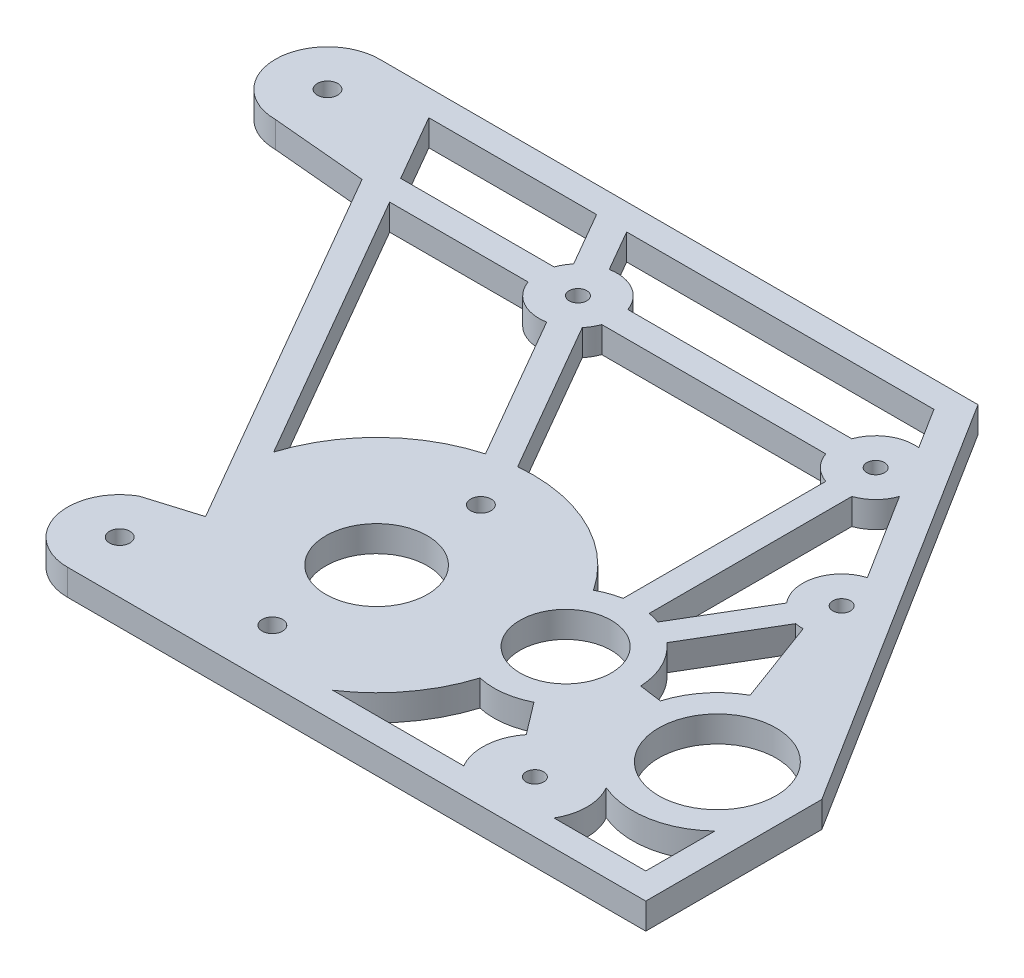
from build123d import *

# Parameters (mm, degrees)
SKETCH1_R           = 2.4892
SKETCH1_R_2         = 14.3002
SKETCH1_R_3         = 11.1252
SKETCH1_R_4         = 12.3825
BOSS_EXTRUDE1_DEPTH = 6.35
SKETCH2_R           = 2.15265
CUT_EXTRUDE2_DEPTH  = 196.570791382


with BuildPart() as part:
    # Sketch1 → Boss-Extrude1 (new body)
    with BuildSketch(Plane(origin=(0, 0, 0), x_dir=(1, 0, 0), z_dir=(0, 1, 0))):
        with BuildLine():
            ThreePointArc((-168.788743889, 72.590962133), (-181.488743889, 59.890962122), (-168.788743866, 47.190962133))
            Line((-168.788743866, 47.190962133), (-145.58139547, 45.094655563))
            Line((-145.58139547, 45.094655563), (-93.510572414, -45.094655563))
            Line((-93.510572414, -45.094655563), (-105.98261767, -48.892439505))
            ThreePointArc((-105.98261767, -48.892439505), (-111.899875664, -63.177964006), (-99.63261767, -72.590962133))
            Line((-99.63261767, -72.590962133), (47.56445351, -72.590962133))
            Line((47.56445351, -72.590962133), (47.56445351, 72.590962133))
            Line((47.56445351, 72.590962133), (-168.788743889, 72.590962133))
        make_face()
        with Locations((-168.788743889, 59.890962133)):
            Circle(SKETCH1_R, mode=Mode.SUBTRACT)
        with Locations((20.56425351, -34.490962133)):
            Circle(SKETCH1_R_2, mode=Mode.SUBTRACT)
        with Locations((-22.22178223, -28.671379192)):
            Circle(SKETCH1_R_3, mode=Mode.SUBTRACT)
        with Locations((-62.44294649, -9.090962133)):
            Circle(SKETCH1_R, mode=Mode.SUBTRACT)
        with Locations((-62.44294649, -34.490962133)):
            Circle(SKETCH1_R_4, mode=Mode.SUBTRACT)
        with Locations((-62.44294649, -59.890962133)):
            Circle(SKETCH1_R, mode=Mode.SUBTRACT)
        with Locations((-99.63261767, -59.890962133)):
            Circle(SKETCH1_R, mode=Mode.SUBTRACT)
    extrude(amount=BOSS_EXTRUDE1_DEPTH)

    # Sketch2 → Cut-Extrude2 (cut, through all)
    with BuildSketch(Plane(origin=(0, 6.35, 0), x_dir=(1, 0, 0), z_dir=(0, 1, 0))):
        with BuildLine():
            Line((-109.602027453, 66.240962133), (-150.457872842, 66.240962133))
            Line((-150.457872842, 66.240962133), (-141.094562242, 50.023232447))
            Line((-141.094562242, 50.023232447), (-103.71971166, 50.023232447))
            ThreePointArc((-103.71971166, 50.023232447), (-102.98834751, 51.610732447), (-101.979214256, 53.03786238))
            Line((-101.979214256, 53.03786238), (-109.602027453, 66.240962133))
        make_face()
        with BuildLine():
            Line((-27.415955353, 66.240962133), (-102.269679034, 66.240962133))
            Line((-102.269679034, 66.240962133), (-96.479952942, 56.21286238))
            ThreePointArc((-96.479952942, 56.21286238), (-89.976955539, 55.097124418), (-85.759199418, 50.023232447))
            Line((-85.759199418, 50.023232447), (-31.202038352, 50.023232447))
            ThreePointArc((-31.202038352, 50.023232447), (-27.287897574, 54.914216598), (-21.182472547, 56.31636111))
            Line((-21.182472547, 56.31636111), (-27.415955353, 66.240962133))
        make_face()
        Polygon((-23.035115437, 72.590962133), (41.21445351, -29.703590933), (41.21445351, -72.590962133), (47.56445351, -72.590962133), (47.56445351, 72.590962133), align=None)
        with BuildLine():
            Line((-103.71971166, 43.673232447), (-137.428388033, 43.673232447))
            Line((-137.428388033, 43.673232447), (-98.827143013, -23.186085162))
            ThreePointArc((-98.827143013, -23.186085162), (-88.972030152, -7.144706081), (-72.639137705, 2.219359096))
            Line((-72.639137705, 2.219359096), (-92.998958135, 37.483602514))
            ThreePointArc((-92.998958135, 37.483602514), (-99.501955539, 38.599340476), (-103.71971166, 43.673232447))
        make_face()
        with BuildLine():
            ThreePointArc((-26.036833474, -45.725059119), (-31.933433069, -57.311557893), (-41.382379071, -66.240962133))
            Line((-41.382379071, -66.240962133), (-9.484269118, -66.240962133))
            ThreePointArc((-9.484269118, -66.240962133), (-11.152631367, -58.974431983), (-8.455564218, -52.023768575))
            Line((-8.455564218, -52.023768575), (-14.348733734, -44.272588197))
            ThreePointArc((-14.348733734, -44.272588197), (-20.066729245, -46.013188834), (-26.036833474, -45.725059119))
        make_face()
        with BuildLine():
            Line((-87.499696821, 40.658602514), (-66.012373687, 3.441467126))
            ThreePointArc((-66.012373687, 3.441467126), (-46.037667348, -0.103801502), (-30.714155868, -13.398455272))
            ThreePointArc((-30.714155868, -13.398455272), (-28.133236556, -12.226400542), (-25.39678223, -11.487026133))
            Line((-25.39678223, -11.487026133), (-25.39678223, 37.867976326))
            ThreePointArc((-25.39678223, 37.867976326), (-28.956974321, 40.113040356), (-31.202038352, 43.673232447))
            Line((-31.202038352, 43.673232447), (-85.759199418, 43.673232447))
            ThreePointArc((-85.759199418, 43.673232447), (-86.490563568, 42.085732447), (-87.499696821, 40.658602514))
        make_face()
        with BuildLine():
            Line((-0.032923472, 22.643237608), (-13.241526109, 43.673232447))
            ThreePointArc((-13.241526109, 43.673232447), (-15.48659014, 40.113040356), (-19.04678223, 37.867976326))
            Line((-19.04678223, 37.867976326), (-19.04678223, -11.487026133))
            ThreePointArc((-19.04678223, -11.487026133), (-17.602770585, -11.817674956), (-16.191951442, -12.269435535))
            Line((-16.191951442, -12.269435535), (-4.509739846, 7.442564285))
            ThreePointArc((-4.509739846, 7.442564285), (-6.336897432, 16.240268394), (-0.032923472, 22.643237608))
        make_face()
        with BuildLine():
            ThreePointArc((12.486538167, -53.495731926), (14.214226599, -59.864817331), (12.512776138, -66.240962133))
            Line((12.512776138, -66.240962133), (34.86445351, -66.240962133))
            Line((34.86445351, -66.240962133), (34.86445351, -49.388446484))
            ThreePointArc((34.86445351, -49.388446484), (24.29215872, -54.801882417), (12.486538167, -53.495731926))
        make_face()
        with BuildLine():
            ThreePointArc((2.936724983, 4.025278528), (1.940142116, 4.063195995), (0.952986623, 4.205108568))
            Line((0.952986623, 4.205108568), (-10.729224972, -15.506891252))
            ThreePointArc((-10.729224972, -15.506891252), (-6.488632291, -21.065420473), (-4.766304695, -27.841367715))
            Line((-4.766304695, -27.841367715), (0.773671741, -28.594892827))
            ThreePointArc((0.773671741, -28.594892827), (4.454113042, -21.572210873), (10.509484328, -16.45398964))
            Line((10.509484328, -16.45398964), (2.936724983, 4.025278528))
        make_face()
        with Locations((1.51425351, -59.890962133)):
            Circle(SKETCH2_R)
        with Locations((-94.739455539, 46.848232447)):
            Circle(SKETCH2_R)
        with Locations((-22.22178223, 46.848232447)):
            Circle(SKETCH2_R)
        with Locations((2.800077171, 13.549298288)):
            Circle(SKETCH2_R)
    extrude(amount=-CUT_EXTRUDE2_DEPTH, mode=Mode.SUBTRACT)


solid = part.part
